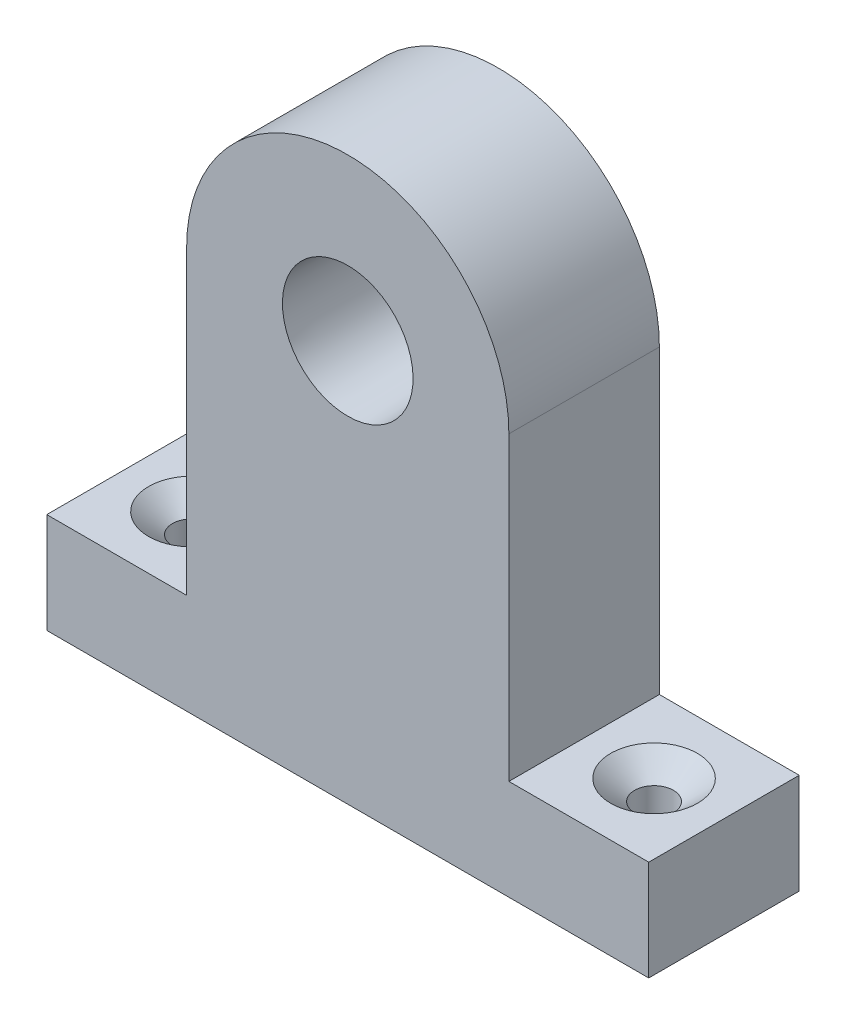
from build123d import *

# Parameters (mm, degrees)
SKETCH1_W                                         = 76.2
SKETCH1_H                                         = 19.05
BOSS_EXTRUDE1_DEPTH                               = 104.14
CUT_EXTRUDE1_DEPTH                                = 131.346801265
CSK_FOR_8_FLAT_HEAD_MACHINE_SCREW_100_D           = 4.9149
CSK_FOR_8_FLAT_HEAD_MACHINE_SCREW_100_CSINK_D     = 10.9728
CSK_FOR_8_FLAT_HEAD_MACHINE_SCREW_100_CSINK_ANGLE = 100


# Read off the part's stored shape, not the designer's step: SurfaceCut1
with BuildPart() as part:
    # Sketch1 → Boss-Extrude1 (new body)
    with BuildSketch(Plane(origin=(0, 19.05, 0), x_dir=(1, 0, 0), z_dir=(0, 1, 0))):
        with Locations((0, 98.425)):
            Rectangle(SKETCH1_W, SKETCH1_H)
    extrude(amount=BOSS_EXTRUDE1_DEPTH)

    # SurfaceCut1 outline → SurfaceCut1 (revolve, cut)
    with BuildSketch(Plane.XZ.offset(-69.85)):
        Polygon((8.266242493, -88.9), (0, -88.9), (0, -107.95), (7.696303968, -107.95), align=None)
    revolve(axis=Axis((0, 69.85, 0), (0, 0, 1)), mode=Mode.SUBTRACT)

    # Sketch3 → Cut-Extrude1 (cut, through all)
    with BuildSketch(Plane(origin=(0, 0, -107.95), x_dir=(-1, 0, 0), z_dir=(0, 0, -1))):
        with BuildLine():
            Line((25.4, 31.75), (37.1816, 31.75))
            Line((37.1816, 31.75), (38.1, 31.75))
            Line((38.1, 31.75), (38.1, 123.19))
            Line((38.1, 123.19), (-38.1, 123.19))
            Line((-38.1, 123.19), (-38.1, 31.75))
            Line((-38.1, 31.75), (-37.1816, 31.75))
            Line((-37.1816, 31.75), (-25.4, 31.75))
            Line((-25.4, 31.75), (-20.396303968, 31.75))
            Line((-20.396303968, 31.75), (-20.396303968, 69.85))
            ThreePointArc((-20.396303968, 69.85), (0, 90.246303968), (20.396303968, 69.85))
            Line((20.396303968, 69.85), (20.396303968, 31.75))
            Line((20.396303968, 31.75), (25.4, 31.75))
        make_face()
    extrude(amount=-CUT_EXTRUDE1_DEPTH, mode=Mode.SUBTRACT)

    # CSK for #8 Flat Head Machine Screw (100)1 (through all)
    with Locations(Plane(origin=(0, 31.75, 0), x_dir=(1, 0, 0), z_dir=(0, 1, 0))):
        with Locations((-29.248151984, 98.425), (29.248151984, 98.425)):
            CounterSinkHole(CSK_FOR_8_FLAT_HEAD_MACHINE_SCREW_100_D / 2, CSK_FOR_8_FLAT_HEAD_MACHINE_SCREW_100_CSINK_D / 2, counter_sink_angle=CSK_FOR_8_FLAT_HEAD_MACHINE_SCREW_100_CSINK_ANGLE)


solid = part.part
